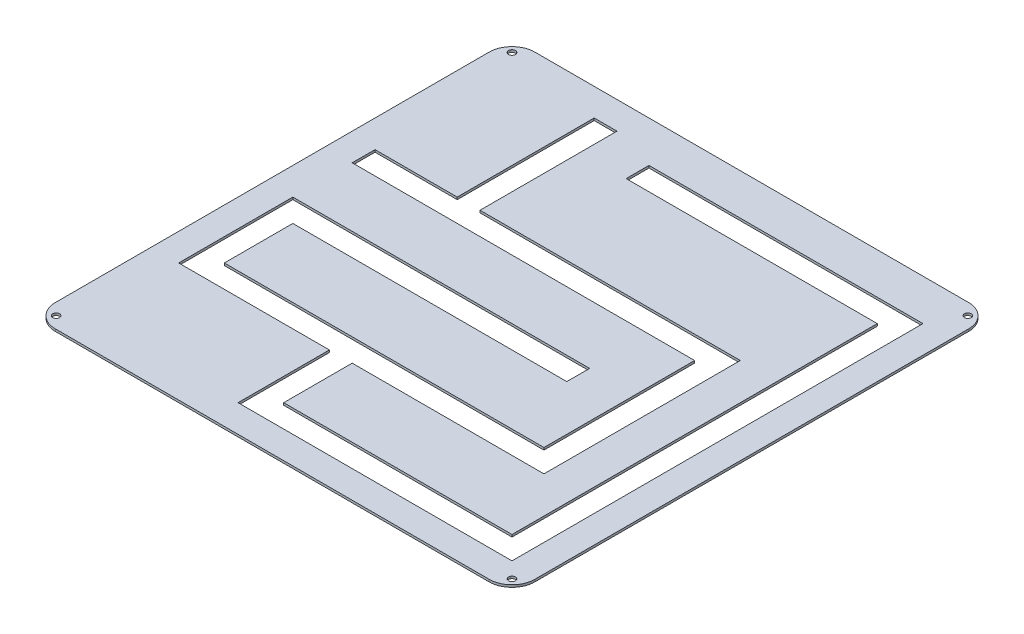
from build123d import *

# Parameters (mm, degrees)
SKETCH1_W         = 210
SKETCH1_H         = 210
MAINEXTRUDE_DEPTH = 1
SKETCH1_6_R       = 1.5
SCREWHOLES_DEPTH  = 1
ROUNDEDCORNERS_R  = 10
TRENCH_DEPTH      = 12


with BuildPart() as part:
    # Sketch1 → MainExtrude (new body)
    with BuildSketch(Plane(origin=(0, 0, 0), x_dir=(1, 0, 0), z_dir=(0, 1, 0))):
        Rectangle(SKETCH1_W, SKETCH1_H)
    extrude(amount=MAINEXTRUDE_DEPTH)

    # Sketch1<6> → ScrewHoles (cut)
    with BuildSketch(Plane(origin=(0, 0, 0), x_dir=(1, 0, 0), z_dir=(0, 1, 0))):
        with Locations(Location((-99.833273811, 99.833273811, 0), (0, 0, 270))):
            Circle(SKETCH1_6_R)
        with Locations(Location((-99.833273811, -99.833273811, 0), (0, 0, 90))):
            Circle(SKETCH1_6_R)
        with Locations(Location((99.833273811, -99.833273811, 0), (0, 0, 270))):
            Circle(SKETCH1_6_R)
        with Locations(Location((99.833273811, 99.833273811, 0), (0, 0, 90))):
            Circle(SKETCH1_6_R)
    extrude(amount=SCREWHOLES_DEPTH, mode=Mode.SUBTRACT)

    # RoundedCorners
    roundedcorners_edges = [part.edges().sort_by_distance(p)[0] for p in [
        (-105, 0.5, -105),
        (-105, 0.5, 105),
        (105, 0.5, 105),
        (105, 0.5, -105),
    ]]
    fillet(roundedcorners_edges, radius=ROUNDEDCORNERS_R)

    # Sketch3 → Trench (cut)
    with BuildSketch(Plane(origin=(0, 0, 0), x_dir=(1, 0, 0), z_dir=(0, 1, 0))):
        Polygon((-57, 93), (-57, 33), (-93, 33), (-93, 23), (57, 23), (57, -43), (-83, -43), (-83, -13), (37, -13), (37, -3), (-93, -3), (-93, -53), (-27, -53), (-27, -93), (93, -93), (93, 87), (-27, 87), (-27, 77), (83, 77), (83, -83), (-17, -83), (-17, -53), (67, -53), (67, 33), (-47, 33), (-47, 93), align=None)
    extrude(amount=TRENCH_DEPTH, mode=Mode.SUBTRACT)


solid = part.part
